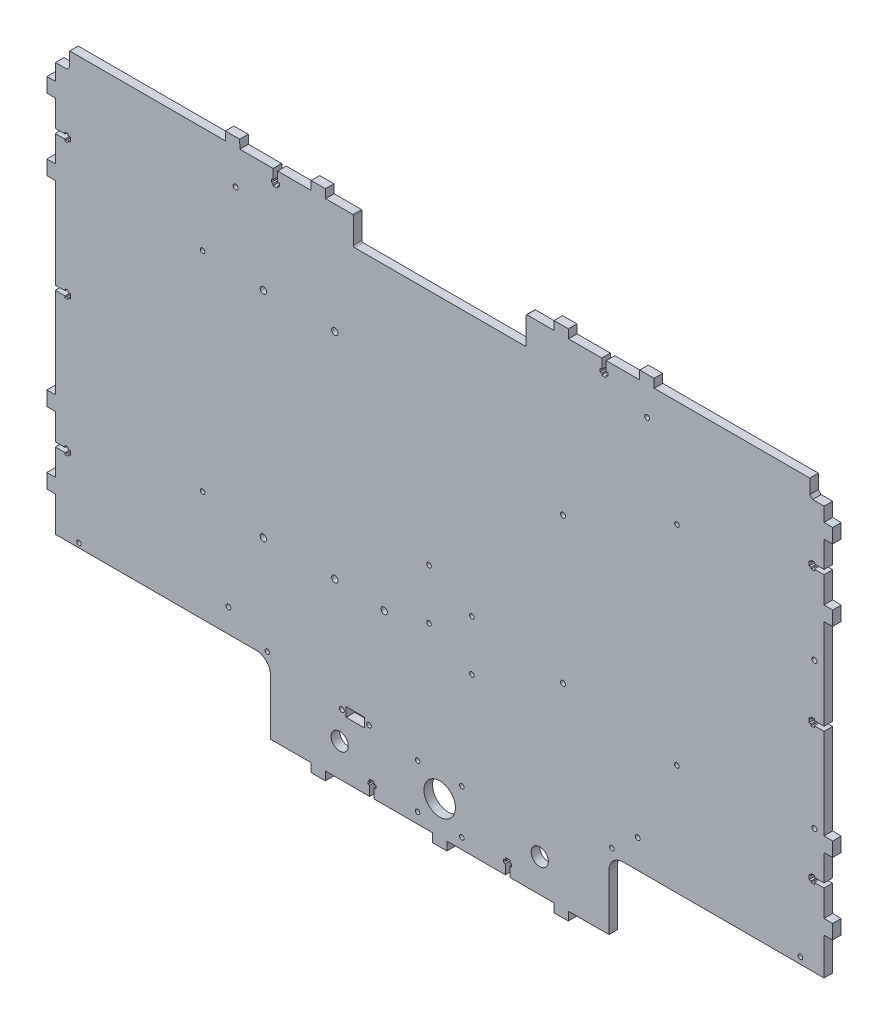
from build123d import *

# Parameters (mm, degrees)
SKETCH_1_R      = 1.6
SKETCH_1_R_2    = 1.7
SKETCH_1_R_3    = 6
SKETCH_1_W      = 13
SKETCH_1_H      = 6.5
SKETCH_1_R_4    = 1.626470027
SKETCH_1_R_5    = 2.25
SKETCH_1_R_6    = 11
SKETCH_1_R_7    = 1.75
EXTRUDE_1_DEPTH = 6


with BuildPart() as part:
    # Эскиз1 → Бобышка-Вытянуть1 (new body)
    with BuildSketch(Plane.XY):
        with BuildLine():
            Line((89.741925364, 539.042043616), (89.741925364, 500.137589553))
            Line((89.741925364, 500.137589553), (118.091925364, 500.137589553))
            Line((118.091925364, 500.137589553), (118.191925364, 494.137589553))
            Line((118.191925364, 494.137589553), (128.191925364, 494.137589553))
            Line((128.191925364, 494.137589553), (128.291925364, 500.137589553))
            Line((128.291925364, 500.137589553), (159.141925364, 500.137589553))
            Line((159.141925364, 500.137589553), (159.141925364, 506.937589553))
            Line((159.141925364, 506.937589553), (157.941925364, 506.937589553))
            Line((157.941925364, 506.937589553), (157.941925364, 509.137589553))
            Line((157.941925364, 509.137589553), (159.141925364, 509.137589553))
            Line((159.141925364, 509.137589553), (159.141925364, 510.637589553))
            Line((159.141925364, 510.637589553), (162.241925364, 510.637589553))
            Line((162.241925364, 510.637589553), (162.241925364, 509.137589553))
            Line((162.241925364, 509.137589553), (163.441925364, 509.137589553))
            Line((163.441925364, 509.137589553), (163.441925364, 506.937589553))
            Line((163.441925364, 506.937589553), (162.241925364, 506.937589553))
            Line((162.241925364, 506.937589553), (162.241925364, 500.137589553))
            Line((162.241925364, 500.137589553), (203.091925364, 500.137589553))
            Line((203.091925364, 500.137589553), (203.191925364, 494.137589553))
            Line((203.191925364, 494.137589553), (213.191925364, 494.137589553))
            Line((213.191925364, 494.137589553), (213.291925364, 500.137589553))
            Line((213.291925364, 500.137589553), (254.141925364, 500.137589553))
            Line((254.141925364, 500.137589553), (254.141925364, 506.937589553))
            Line((254.141925364, 506.937589553), (252.941925364, 506.937589553))
            Line((252.941925364, 506.937589553), (252.941925364, 509.137589553))
            Line((252.941925364, 509.137589553), (254.141925364, 509.137589553))
            Line((254.141925364, 509.137589553), (254.141925364, 510.637589553))
            Line((254.141925364, 510.637589553), (257.241925364, 510.637589553))
            Line((257.241925364, 510.637589553), (257.241925364, 509.137589553))
            Line((257.241925364, 509.137589553), (258.441925364, 509.137589553))
            Line((258.441925364, 509.137589553), (258.441925364, 506.937589553))
            Line((258.441925364, 506.937589553), (257.241925364, 506.937589553))
            Line((257.241925364, 506.937589553), (257.241925364, 500.137589553))
            Line((257.241925364, 500.137589553), (288.091925364, 500.137589553))
            Line((288.091925364, 500.137589553), (288.191925364, 494.137589553))
            Line((288.191925364, 494.137589553), (298.191925364, 494.137589553))
            Line((298.191925364, 494.137589553), (298.291925364, 500.137589553))
            Line((298.291925364, 500.137589553), (326.641925364, 500.137589553))
            Line((326.641925364, 500.137589553), (326.641925364, 539.137589553))
            ThreePointArc((326.641925364, 539.137589553), (329.570857552, 546.208657365), (336.641925364, 549.137589553))
            Line((336.641925364, 549.137589553), (377.191925364, 549.137589553))
            Line((377.191925364, 549.137589553), (477.191925364, 549.137589553))
            Line((477.191925364, 549.137589553), (477.191925364, 575.087589553))
            Line((477.191925364, 575.087589553), (483.191925364, 575.187589553))
            Line((483.191925364, 575.187589553), (483.191925364, 585.187589553))
            Line((483.191925364, 585.187589553), (477.191925364, 585.287589553))
            Line((477.191925364, 585.287589553), (477.191925364, 603.637589553))
            Line((477.191925364, 603.637589553), (470.391925364, 603.637589553))
            Line((470.391925364, 603.637589553), (470.391925364, 602.437589553))
            Line((470.391925364, 602.437589553), (468.191925364, 602.437589553))
            Line((468.191925364, 602.437589553), (468.191925364, 603.637589553))
            Line((468.191925364, 603.637589553), (466.691925364, 603.637589553))
            Line((466.691925364, 603.637589553), (466.691925364, 606.737589553))
            Line((466.691925364, 606.737589553), (468.191925364, 606.737589553))
            Line((468.191925364, 606.737589553), (468.191925364, 607.937589553))
            Line((468.191925364, 607.937589553), (470.391925364, 607.937589553))
            Line((470.391925364, 607.937589553), (470.391925364, 606.737589553))
            Line((470.391925364, 606.737589553), (477.191925364, 606.737589553))
            Line((477.191925364, 606.737589553), (477.191925364, 625.087589553))
            Line((477.191925364, 625.087589553), (483.191925364, 625.187589553))
            Line((483.191925364, 625.187589553), (483.191925364, 635.187589553))
            Line((483.191925364, 635.187589553), (477.191925364, 635.287589553))
            Line((477.191925364, 635.287589553), (477.191925364, 698.637589553))
            Line((477.191925364, 698.637589553), (470.391925364, 698.637589553))
            Line((470.391925364, 698.637589553), (470.391925364, 697.437589553))
            Line((470.391925364, 697.437589553), (468.191925364, 697.437589553))
            Line((468.191925364, 697.437589553), (468.191925364, 698.637589553))
            Line((468.191925364, 698.637589553), (466.691925364, 698.637589553))
            Line((466.691925364, 698.637589553), (466.691925364, 701.737589553))
            Line((466.691925364, 701.737589553), (468.191925364, 701.737589553))
            Line((468.191925364, 701.737589553), (468.191925364, 702.937589553))
            Line((468.191925364, 702.937589553), (470.391925364, 702.937589553))
            Line((470.391925364, 702.937589553), (470.391925364, 701.737589553))
            Line((470.391925364, 701.737589553), (477.191925364, 701.737589553))
            Line((477.191925364, 701.737589553), (477.191925364, 765.087589553))
            Line((477.191925364, 765.087589553), (483.191925364, 765.187589553))
            Line((483.191925364, 765.187589553), (483.191925364, 775.187589553))
            Line((483.191925364, 775.187589553), (477.191925364, 775.287589553))
            Line((477.191925364, 775.287589553), (477.191925364, 793.637589553))
            Line((477.191925364, 793.637589553), (470.391925364, 793.637589553))
            Line((470.391925364, 793.637589553), (470.391925364, 792.437589553))
            Line((470.391925364, 792.437589553), (468.191925364, 792.437589553))
            Line((468.191925364, 792.437589553), (468.191925364, 793.637589553))
            Line((468.191925364, 793.637589553), (466.691925364, 793.637589553))
            Line((466.691925364, 793.637589553), (466.691925364, 796.737589553))
            Line((466.691925364, 796.737589553), (468.191925364, 796.737589553))
            Line((468.191925364, 796.737589553), (468.191925364, 797.937589553))
            Line((468.191925364, 797.937589553), (470.391925364, 797.937589553))
            Line((470.391925364, 797.937589553), (470.391925364, 796.737589553))
            Line((470.391925364, 796.737589553), (477.191925364, 796.737589553))
            Line((477.191925364, 796.737589553), (477.191925364, 815.087589553))
            Line((477.191925364, 815.087589553), (483.191925364, 815.187589553))
            Line((483.191925364, 815.187589553), (483.191925364, 825.187589553))
            Line((483.191925364, 825.187589553), (477.191925364, 825.287589553))
            Line((477.191925364, 825.287589553), (477.191925364, 835.137589553))
            Line((477.191925364, 835.137589553), (469.191925364, 835.137589553))
            Line((469.191925364, 835.137589553), (467.191925364, 837.137589553))
            Line((467.191925364, 837.137589553), (467.191925364, 847.137589553))
            Line((467.191925364, 847.137589553), (367.191925364, 847.137589553))
            Line((367.191925364, 847.137589553), (358.291925364, 847.137589553))
            Line((358.291925364, 847.137589553), (358.191925364, 853.137589553))
            Line((358.191925364, 853.137589553), (348.191925364, 853.137589553))
            Line((348.191925364, 853.137589553), (348.091925364, 847.137589553))
            Line((348.091925364, 847.137589553), (324.741925364, 847.137589553))
            Line((324.741925364, 847.137589553), (324.741925364, 840.337589553))
            Line((324.741925364, 840.337589553), (325.941925364, 840.337589553))
            Line((325.941925364, 840.337589553), (325.941925364, 838.137589553))
            Line((325.941925364, 838.137589553), (324.741925364, 838.137589553))
            Line((324.741925364, 838.137589553), (324.741925364, 836.637589553))
            Line((324.741925364, 836.637589553), (321.641925364, 836.637589553))
            Line((321.641925364, 836.637589553), (321.641925364, 838.137589553))
            Line((321.641925364, 838.137589553), (320.441925364, 838.137589553))
            Line((320.441925364, 838.137589553), (320.441925364, 840.337589553))
            Line((320.441925364, 840.337589553), (321.641925364, 840.337589553))
            Line((321.641925364, 840.337589553), (321.641925364, 847.137589553))
            Line((321.641925364, 847.137589553), (298.291925364, 847.137589553))
            Line((298.291925364, 847.137589553), (298.191925364, 853.137589553))
            Line((298.191925364, 853.137589553), (288.191925364, 853.137589553))
            Line((288.191925364, 853.137589553), (288.091925364, 847.137589553))
            Line((288.091925364, 847.137589553), (269.191925364, 847.137589553))
            ThreePointArc((269.191925364, 847.137589553), (268.838371974, 846.991142943), (268.691925364, 846.637589553))
            Line((268.691925364, 846.637589553), (268.691925364, 828.542043616))
            ThreePointArc((268.691925364, 828.542043616), (268.399032145, 827.834936835), (267.691925364, 827.542043616))
            Line((267.691925364, 827.542043616), (148.691925364, 827.542043616))
            ThreePointArc((148.691925364, 827.542043616), (147.984818583, 827.834936835), (147.691925364, 828.542043616))
            Line((147.691925364, 828.542043616), (147.691925364, 846.542043616))
            ThreePointArc((147.691925364, 846.542043616), (147.545478755, 846.895597007), (147.191925364, 847.042043616))
            Line((147.191925364, 847.042043616), (128.291925364, 847.042043616))
            Line((128.291925364, 847.042043616), (128.191925364, 853.042043616))
            Line((128.191925364, 853.042043616), (118.191925364, 853.042043616))
            Line((118.191925364, 853.042043616), (118.091925364, 847.042043616))
            Line((118.091925364, 847.042043616), (94.741925364, 847.042043616))
            Line((94.741925364, 847.042043616), (94.741925364, 840.242043616))
            Line((94.741925364, 840.242043616), (95.941925364, 840.242043616))
            Line((95.941925364, 840.242043616), (95.941925364, 838.042043616))
            Line((95.941925364, 838.042043616), (94.741925364, 838.042043616))
            Line((94.741925364, 838.042043616), (94.741925364, 836.542043616))
            Line((94.741925364, 836.542043616), (91.641925364, 836.542043616))
            Line((91.641925364, 836.542043616), (91.641925364, 838.042043616))
            Line((91.641925364, 838.042043616), (90.441925364, 838.042043616))
            Line((90.441925364, 838.042043616), (90.441925364, 840.242043616))
            Line((90.441925364, 840.242043616), (91.641925364, 840.242043616))
            Line((91.641925364, 840.242043616), (91.641925364, 847.042043616))
            Line((91.641925364, 847.042043616), (68.291925364, 847.042043616))
            Line((68.291925364, 847.042043616), (68.191925364, 853.042043616))
            Line((68.191925364, 853.042043616), (58.191925364, 853.042043616))
            Line((58.191925364, 853.042043616), (58.091925364, 847.042043616))
            Line((58.091925364, 847.042043616), (49.191925364, 847.042043616))
            Line((49.191925364, 847.042043616), (-50.808074636, 847.042043616))
            Line((-50.808074636, 847.042043616), (-50.808074636, 837.042043616))
            Line((-50.808074636, 837.042043616), (-52.808074636, 835.042043616))
            Line((-52.808074636, 835.042043616), (-60.808074636, 835.042043616))
            Line((-60.808074636, 835.042043616), (-60.808074636, 823.642043616))
            Line((-60.808074636, 823.642043616), (-66.808074636, 823.542043616))
            Line((-66.808074636, 823.542043616), (-66.808074636, 813.542043616))
            Line((-66.808074636, 813.542043616), (-60.808074636, 813.442043616))
            Line((-60.808074636, 813.442043616), (-60.808074636, 795.092043616))
            Line((-60.808074636, 795.092043616), (-54.008074636, 795.092043616))
            Line((-54.008074636, 795.092043616), (-54.008074636, 796.292043616))
            Line((-54.008074636, 796.292043616), (-51.808074636, 796.292043616))
            Line((-51.808074636, 796.292043616), (-51.808074636, 795.092043616))
            Line((-51.808074636, 795.092043616), (-50.308074636, 795.092043616))
            Line((-50.308074636, 795.092043616), (-50.308074636, 791.992043616))
            Line((-50.308074636, 791.992043616), (-51.808074636, 791.992043616))
            Line((-51.808074636, 791.992043616), (-51.808074636, 790.792043616))
            Line((-51.808074636, 790.792043616), (-54.008074636, 790.792043616))
            Line((-54.008074636, 790.792043616), (-54.008074636, 791.992043616))
            Line((-54.008074636, 791.992043616), (-60.808074636, 791.992043616))
            Line((-60.808074636, 791.992043616), (-60.808074636, 773.642043616))
            Line((-60.808074636, 773.642043616), (-66.808074636, 773.542043616))
            Line((-66.808074636, 773.542043616), (-66.808074636, 763.542043616))
            Line((-66.808074636, 763.542043616), (-60.808074636, 763.442043616))
            Line((-60.808074636, 763.442043616), (-60.808074636, 700.092043616))
            Line((-60.808074636, 700.092043616), (-54.008074636, 700.092043616))
            Line((-54.008074636, 700.092043616), (-54.008074636, 701.292043616))
            Line((-54.008074636, 701.292043616), (-51.808074636, 701.292043616))
            Line((-51.808074636, 701.292043616), (-51.808074636, 700.092043616))
            Line((-51.808074636, 700.092043616), (-50.308074636, 700.092043616))
            Line((-50.308074636, 700.092043616), (-50.308074636, 696.992043616))
            Line((-50.308074636, 696.992043616), (-51.808074636, 696.992043616))
            Line((-51.808074636, 696.992043616), (-51.808074636, 695.792043616))
            Line((-51.808074636, 695.792043616), (-54.008074636, 695.792043616))
            Line((-54.008074636, 695.792043616), (-54.008074636, 696.992043616))
            Line((-54.008074636, 696.992043616), (-60.808074636, 696.992043616))
            Line((-60.808074636, 696.992043616), (-60.808074636, 633.642043616))
            Line((-60.808074636, 633.642043616), (-66.808074636, 633.542043616))
            Line((-66.808074636, 633.542043616), (-66.808074636, 623.542043616))
            Line((-66.808074636, 623.542043616), (-60.808074636, 623.442043616))
            Line((-60.808074636, 623.442043616), (-60.808074636, 605.092043616))
            Line((-60.808074636, 605.092043616), (-54.008074636, 605.092043616))
            Line((-54.008074636, 605.092043616), (-54.008074636, 606.292043616))
            Line((-54.008074636, 606.292043616), (-51.808074636, 606.292043616))
            Line((-51.808074636, 606.292043616), (-51.808074636, 605.092043616))
            Line((-51.808074636, 605.092043616), (-50.308074636, 605.092043616))
            Line((-50.308074636, 605.092043616), (-50.308074636, 601.992043616))
            Line((-50.308074636, 601.992043616), (-51.808074636, 601.992043616))
            Line((-51.808074636, 601.992043616), (-51.808074636, 600.792043616))
            Line((-51.808074636, 600.792043616), (-54.008074636, 600.792043616))
            Line((-54.008074636, 600.792043616), (-54.008074636, 601.992043616))
            Line((-54.008074636, 601.992043616), (-60.808074636, 601.992043616))
            Line((-60.808074636, 601.992043616), (-60.808074636, 583.642043616))
            Line((-60.808074636, 583.642043616), (-66.808074636, 583.542043616))
            Line((-66.808074636, 583.542043616), (-66.808074636, 573.542043616))
            Line((-66.808074636, 573.542043616), (-60.808074636, 573.442043616))
            Line((-60.808074636, 573.442043616), (-60.808074636, 549.042043616))
            Line((-60.808074636, 549.042043616), (39.191925364, 549.042043616))
            Line((39.191925364, 549.042043616), (79.741925364, 549.042043616))
            ThreePointArc((79.741925364, 549.042043616), (86.812993176, 546.113111428), (89.741925364, 539.042043616))
        make_face()
        with Locations((-44.258074636, 552.137589553)):
            Circle(SKETCH_1_R, mode=Mode.SUBTRACT)
        with Locations((60.306923435, 565.643369962)):
            Circle(SKETCH_1_R_2, mode=Mode.SUBTRACT)
        with Locations((138.191925364, 523.137589553)):
            Circle(SKETCH_1_R_3, mode=Mode.SUBTRACT)
        with Locations((192.691925364, 507.637589553)):
            Circle(SKETCH_1_R, mode=Mode.SUBTRACT)
        with Locations((192.691925364, 538.637589553)):
            Circle(SKETCH_1_R, mode=Mode.SUBTRACT)
        with Locations((87.541925364, 552.137589553)):
            Circle(SKETCH_1_R, mode=Mode.SUBTRACT)
        with Locations((139.700153258, 543.137589553)):
            Circle(SKETCH_1_R_2, mode=Mode.SUBTRACT)
        with Locations((149.200153258, 543.147589553)):
            Rectangle(SKETCH_1_W, SKETCH_1_H, mode=Mode.SUBTRACT)
        with Locations((158.700153258, 543.137589553)):
            Circle(SKETCH_1_R_4, mode=Mode.SUBTRACT)
        with Locations((42.191925364, 626.492043616)):
            Circle(SKETCH_1_R, mode=Mode.SUBTRACT)
        with Locations((84.78568386, 619.788752578)):
            Circle(SKETCH_1_R_5, mode=Mode.SUBTRACT)
        with Locations((134.78568386, 619.788752578)):
            Circle(SKETCH_1_R_5, mode=Mode.SUBTRACT)
        with Locations((169.28568386, 617.788752578)):
            Circle(SKETCH_1_R_5, mode=Mode.SUBTRACT)
        with Locations((200.717653837, 625.897847132)):
            Circle(SKETCH_1_R, mode=Mode.SUBTRACT)
        with Locations((200.717653837, 661.157846204)):
            Circle(SKETCH_1_R, mode=Mode.SUBTRACT)
        with Locations((223.691925364, 507.637589553)):
            Circle(SKETCH_1_R, mode=Mode.SUBTRACT)
        with Locations((208.191925364, 523.137589553)):
            Circle(SKETCH_1_R_6, mode=Mode.SUBTRACT)
        with Locations((223.691925364, 538.637589553)):
            Circle(SKETCH_1_R, mode=Mode.SUBTRACT)
        with Locations((278.191925364, 523.137589553)):
            Circle(SKETCH_1_R_3, mode=Mode.SUBTRACT)
        with Locations((328.741925364, 553.687589553)):
            Circle(SKETCH_1_R, mode=Mode.SUBTRACT)
        with Locations((346.784706522, 569.071596444)):
            Circle(SKETCH_1_R_2, mode=Mode.SUBTRACT)
        with Locations((460.641925364, 553.687589553)):
            Circle(SKETCH_1_R, mode=Mode.SUBTRACT)
        with Locations((230.717653837, 609.897847132)):
            Circle(SKETCH_1_R, mode=Mode.SUBTRACT)
        with Locations((230.717653837, 645.157846204)):
            Circle(SKETCH_1_R, mode=Mode.SUBTRACT)
        with Locations((294.485262853, 636.368280179)):
            Circle(SKETCH_1_R_7, mode=Mode.SUBTRACT)
        with Locations((374.191925364, 626.492043616)):
            Circle(SKETCH_1_R, mode=Mode.SUBTRACT)
        with Locations((470.485262853, 636.368280179)):
            Circle(SKETCH_1_R_7, mode=Mode.SUBTRACT)
        with Locations((42.191925364, 772.492043616)):
            Circle(SKETCH_1_R, mode=Mode.SUBTRACT)
        with Locations((65.280069026, 822.688709986)):
            Circle(SKETCH_1_R_2, mode=Mode.SUBTRACT)
        with Locations((84.78568386, 769.788752578)):
            Circle(SKETCH_1_R_5, mode=Mode.SUBTRACT)
        with Locations((134.78568386, 769.788752578)):
            Circle(SKETCH_1_R_5, mode=Mode.SUBTRACT)
        with Locations((294.485262853, 738.368280179)):
            Circle(SKETCH_1_R_7, mode=Mode.SUBTRACT)
        with Locations((470.485262853, 738.368280179)):
            Circle(SKETCH_1_R_7, mode=Mode.SUBTRACT)
        with Locations((374.191925364, 772.492043616)):
            Circle(SKETCH_1_R, mode=Mode.SUBTRACT)
        with Locations((353.343052835, 826.939418984)):
            Circle(SKETCH_1_R_2, mode=Mode.SUBTRACT)
    extrude(amount=EXTRUDE_1_DEPTH)


solid = part.part
